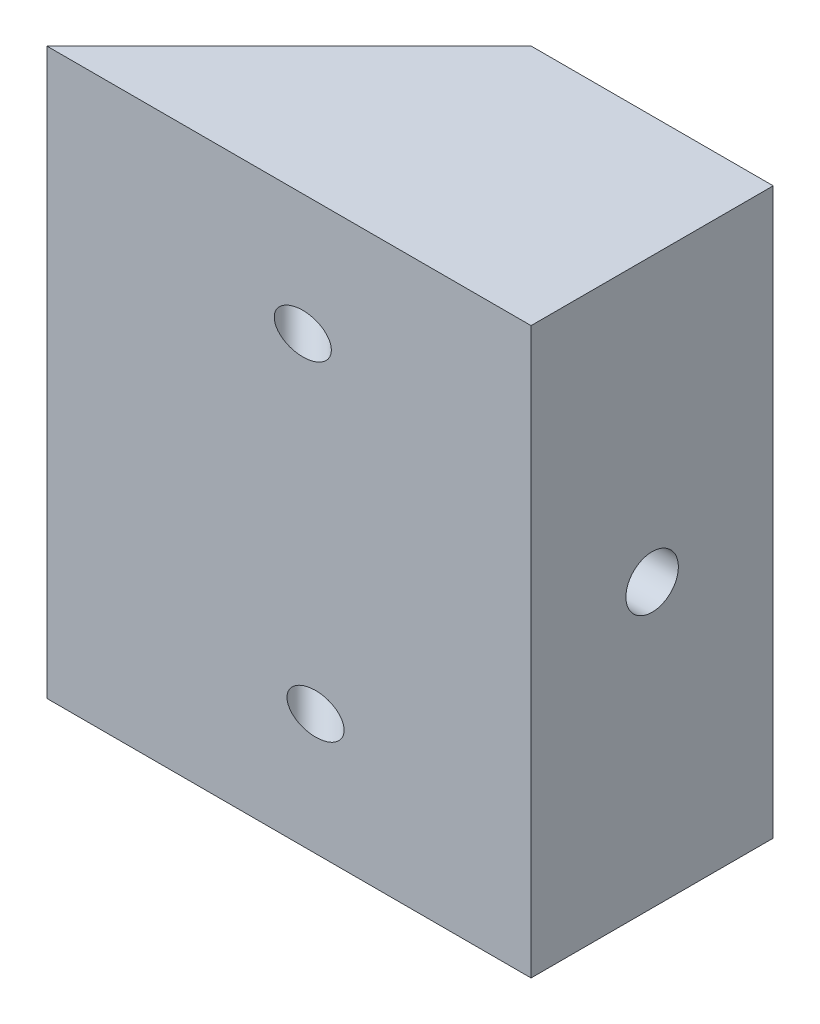
from build123d import *

# Parameters (mm, degrees)
BOSS_EXTRUDE1_DEPTH = 88.9
SKETCH2_R           = 3.175
CUT_EXTRUDE1_DEPTH  = 38.1
SKETCH3_R           = 4.1275
CUT_EXTRUDE2_DEPTH  = 25.4


with BuildPart() as part:
    # Sketch1 → Boss-Extrude1 (new body)
    with BuildSketch(Plane(origin=(0, 0, 0), x_dir=(1, 0, 0), z_dir=(0, 1, 0))):
        Polygon((0, 0), (38.1, 38.1), (76.2, 38.1), (76.2, 0), align=None)
    extrude(amount=BOSS_EXTRUDE1_DEPTH)

    # Sketch2 → Cut-Extrude1 (cut)
    with BuildSketch(Plane(origin=(38.1, 0, 38.1), x_dir=(-0.7071067811865464, 0, 0.7071067811865488), z_dir=(-0.7071067811865488, 0, -0.7071067811865464))):
        with Locations((-28.481536726, 69.85)):
            Circle(SKETCH2_R)
        with Locations((-29.901764766, 19.05)):
            Circle(SKETCH2_R)
    extrude(amount=CUT_EXTRUDE1_DEPTH, mode=Mode.SUBTRACT)

    # Sketch3 → Cut-Extrude2 (cut)
    with BuildSketch(Plane(origin=(76.2, 0, 0), x_dir=(0, 0, -1), z_dir=(1, 0, 0))):
        with Locations((19.05, 44.45)):
            Circle(SKETCH3_R)
    extrude(amount=-CUT_EXTRUDE2_DEPTH, mode=Mode.SUBTRACT)


solid = part.part
